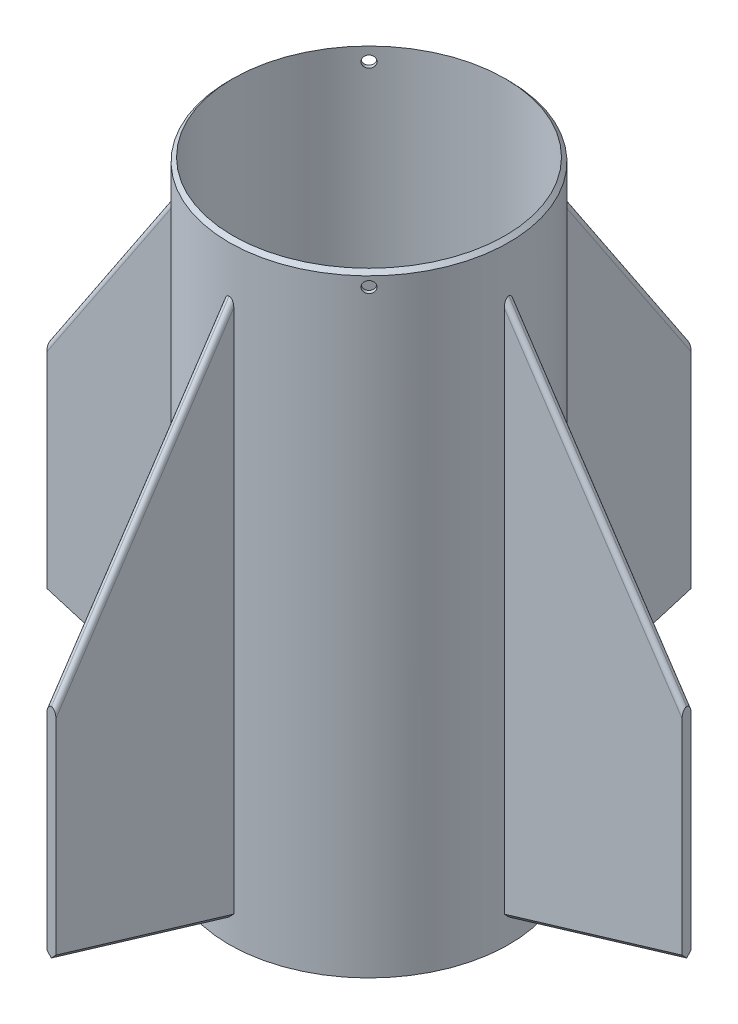
from build123d import *

# Parameters (mm, degrees)
SKETCH1_R                = 78.359
SKETCH1_R_2              = 76.2
BOSS_EXTRUDE1_DEPTH      = 342.9
BOSS_EXTRUDE2_DEPTH      = 2.54
BOSS_EXTRUDE2_DEPTH_BACK = 2.54
FILLET2_R                = 2.54
CHAMFER2_SIZE            = 2.54
CIRPATTERN1_COUNT        = 4
SKETCH4_R                = 3.175
CUT_EXTRUDE1_DEPTH       = 426.212993687
CIRPATTERN2_COUNT        = 4
CHAMFER3_SIZE            = 2.54


# Some blends are built 0.0001 mm under size
with BuildPart() as part:
    # Sketch1 → Boss-Extrude1 (new body)
    with BuildSketch(Plane(origin=(0, 0, 0), x_dir=(1, 0, 0), z_dir=(0, 1, 0))):
        with Locations(Location((0, 0, 0), (0, 0, 270))):
            Circle(SKETCH1_R)
        with Locations(Location((0, 0, 0), (0, 0, 270))):
            Circle(SKETCH1_R_2, mode=Mode.SUBTRACT)
    extrude(amount=BOSS_EXTRUDE1_DEPTH)

    # Sketch4 → Cut-Extrude1 (cut, through all)
    with BuildSketch(Plane(origin=(0, 0, 0), x_dir=(-0.7071067811865462, 0, 0.7071067811865489), z_dir=(-0.7071067811865489, 0, -0.7071067811865462))):
        with Locations((0, 334.9498)):
            Circle(SKETCH4_R)
    cut_extrude1 = extrude(amount=-CUT_EXTRUDE1_DEPTH, mode=Mode.SUBTRACT)

    # CirPattern2: Cut-Extrude1 ×4 about axis
    cirpattern2_axis = Axis((0, -69.284011973, 0), (0, 1, 0))
    for i in range(1, CIRPATTERN2_COUNT):
        add(cut_extrude1.rotate(cirpattern2_axis, i * 360 / CIRPATTERN2_COUNT), mode=Mode.SUBTRACT)

    # Chamfer3
    # the kernel refuses this chamfer: 2.54 mm, written as the material it takes off along each edge
    with BuildSketch(Plane(origin=(0, 342.9, 0), x_dir=(0, 0, 1), z_dir=(-1, 0, 0))) as chamfer3_piece_1:
        Polygon((78.359, -CHAMFER3_SIZE), (78.359 - CHAMFER3_SIZE, 0), (78.359, 0), align=None)
    revolve(axis=Axis((0, 342.9, 0), (0, 1, 0)), mode=Mode.SUBTRACT)


with BuildPart() as body_2:
    # Sketch2 → Boss-Extrude2 (new, two sides: drawn at the far end of the back side and taken through both)
    with BuildSketch(Plane.XY.offset(-BOSS_EXTRUDE2_DEPTH_BACK)):
        Polygon((76.2, 317.5), (76.2, 12.7), (177.8, 43.18), (177.8, 165.1), align=None)
    extrude(amount=BOSS_EXTRUDE2_DEPTH + BOSS_EXTRUDE2_DEPTH_BACK)

    # Fillet2
    fillet2_edges = [body_2.edges().sort_by_distance(p)[0] for p in [
        (127, 241.3, -2.54),
        (127, 241.3, 2.54),
    ]]
    fillet(fillet2_edges, radius=FILLET2_R - 0.0001)  # a hair under: the kernel refuses the full size

    # Chamfer2
    chamfer2_edges = [body_2.edges().sort_by_distance(p)[0] for p in [
        (127, 27.94, -2.54),
        (127, 27.94, 2.54),
    ]]
    chamfer(chamfer2_edges, length=CHAMFER2_SIZE - 0.0001)  # a hair under: the kernel refuses the full size


with BuildPart() as cirpattern1_1:
    # CirPattern1: pattern copy
    add(body_2.part.rotate(Axis((0, 0, 0), (0, 1, 0)), 1 * 360 / CIRPATTERN1_COUNT))


with BuildPart() as cirpattern1_2:
    # CirPattern1: pattern copy
    add(body_2.part.rotate(Axis((0, 0, 0), (0, 1, 0)), 2 * 360 / CIRPATTERN1_COUNT))


with BuildPart() as cirpattern1_3:
    # CirPattern1: pattern copy
    add(body_2.part.rotate(Axis((0, 0, 0), (0, 1, 0)), 3 * 360 / CIRPATTERN1_COUNT))


solid = Compound([part.part, body_2.part, cirpattern1_1.part, cirpattern1_2.part, cirpattern1_3.part])
